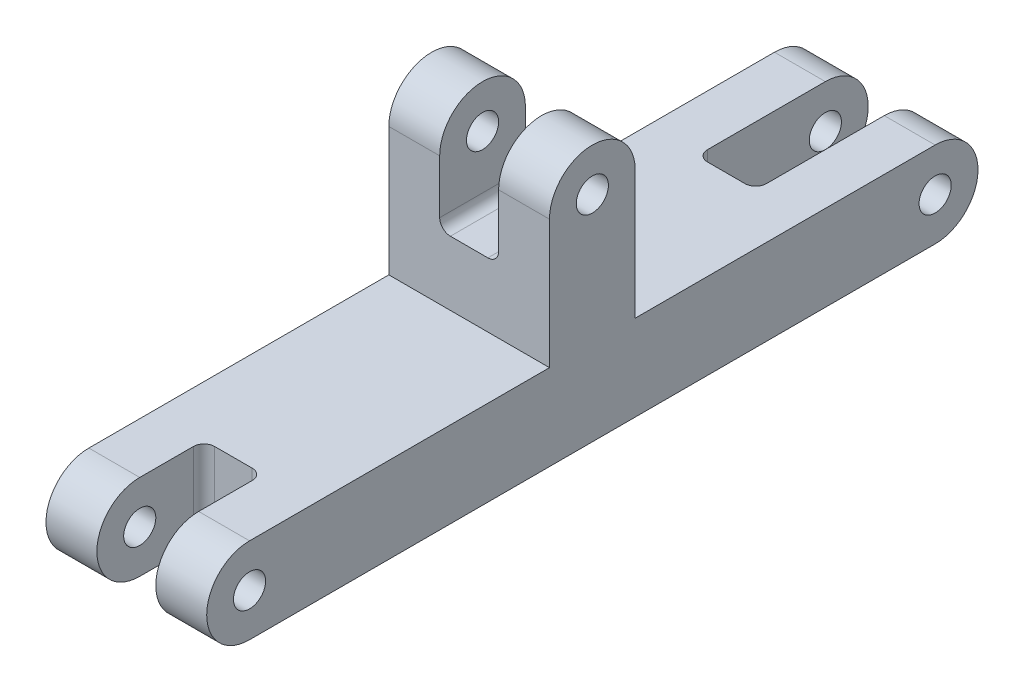
from build123d import *

# Parameters (mm, degrees)
CROQUIS1_R              = 1.5
SALIENTE_EXTRUIR1_DEPTH = 7.5
CROQUIS2_W              = 8
CROQUIS2_H              = 10
CROQUIS2_W_2            = 16
CROQUIS2_H_2            = 8
CROQUIS2_W_3            = 10
CORTAR_EXTRUIR1_DEPTH   = 2.75
REDONDEO1_R             = 1


with BuildPart() as part:
    # Croquis1 → Saliente-Extruir1 (new, symmetric)
    with BuildSketch(Plane(origin=(0, 0, 0), x_dir=(0, 0, -1), z_dir=(1, 0, 0))):
        with BuildLine():
            Line((-15, -4), (15, -4))
            ThreePointArc((15, -4), (19, 0), (15, 4))
            Line((15, 4), (-13, 4))
            Line((-13, 4), (-13, 16))
            ThreePointArc((-13, 16), (-17, 20), (-21, 16))
            Line((-21, 16), (-21, 4))
            Line((-21, 4), (-49, 4))
            ThreePointArc((-49, 4), (-53, 0), (-49, -4))
            Line((-49, -4), (-15, -4))
        make_face()
        with Locations((15, 0)):
            Circle(CROQUIS1_R, mode=Mode.SUBTRACT)
        with Locations((-17, 16)):
            Circle(CROQUIS1_R, mode=Mode.SUBTRACT)
        with Locations((-49, 0)):
            Circle(CROQUIS1_R, mode=Mode.SUBTRACT)
    extrude(amount=SALIENTE_EXTRUIR1_DEPTH, both=True)

    # Croquis2 → Cortar-Extruir1 (cut, symmetric)
    with BuildSketch(Plane(origin=(0, 0, 0), x_dir=(0, 0, -1), z_dir=(1, 0, 0))):
        with Locations((-17, 15)):
            Rectangle(CROQUIS2_W, CROQUIS2_H)
        with Locations((11, 0)):
            Rectangle(CROQUIS2_W_2, CROQUIS2_H_2)
        with Locations((-48, 0)):
            Rectangle(CROQUIS2_W_3, CROQUIS2_H_2)
    extrude(amount=CORTAR_EXTRUIR1_DEPTH, both=True, mode=Mode.SUBTRACT)

    # Redondeo1
    redondeo1_edges = [part.edges().sort_by_distance(p)[0] for p in [
        (2.75, 0, 43),
        (-2.75, 0, 43),
        (2.75, 0, -3),
        (-2.75, 0, -3),
        (2.75, 10, 17),
        (-2.75, 10, 17),
    ]]
    fillet(redondeo1_edges, radius=REDONDEO1_R)


solid = part.part
